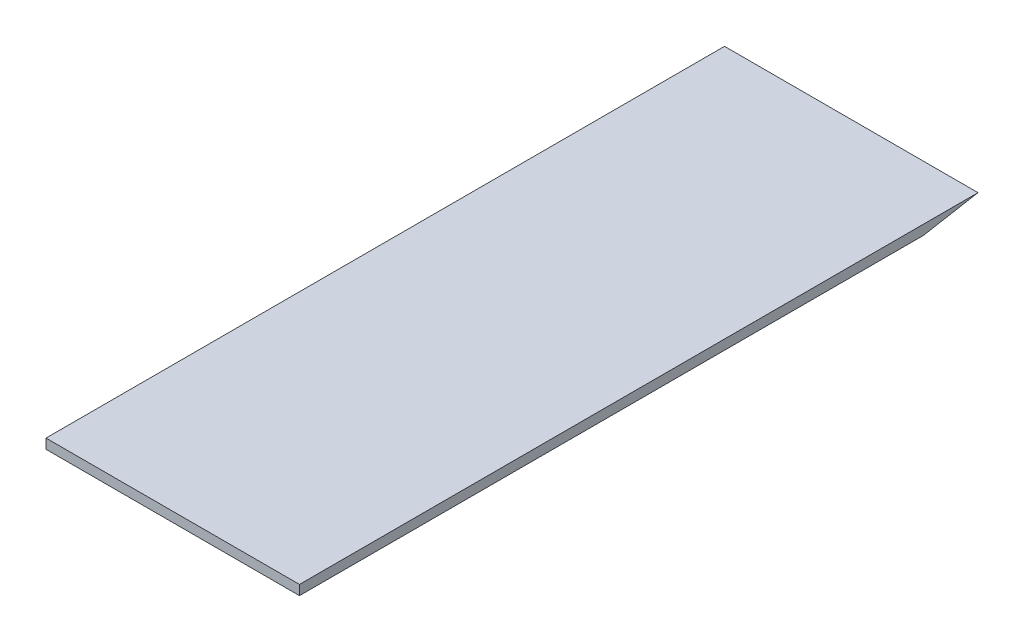
from build123d import *

# Parameters (mm, degrees)
BOSS_EXTRUDE1_DEPTH = 130


with BuildPart() as part:
    # Sketch1 → Boss-Extrude1 (new body)
    with BuildSketch(Plane(origin=(0, 0, 0), x_dir=(0, 0, -1), z_dir=(1, 0, 0))):
        Polygon((0, 5), (0, 0), (320, 0), (348, 5), align=None)
    extrude(amount=BOSS_EXTRUDE1_DEPTH)


solid = part.part
